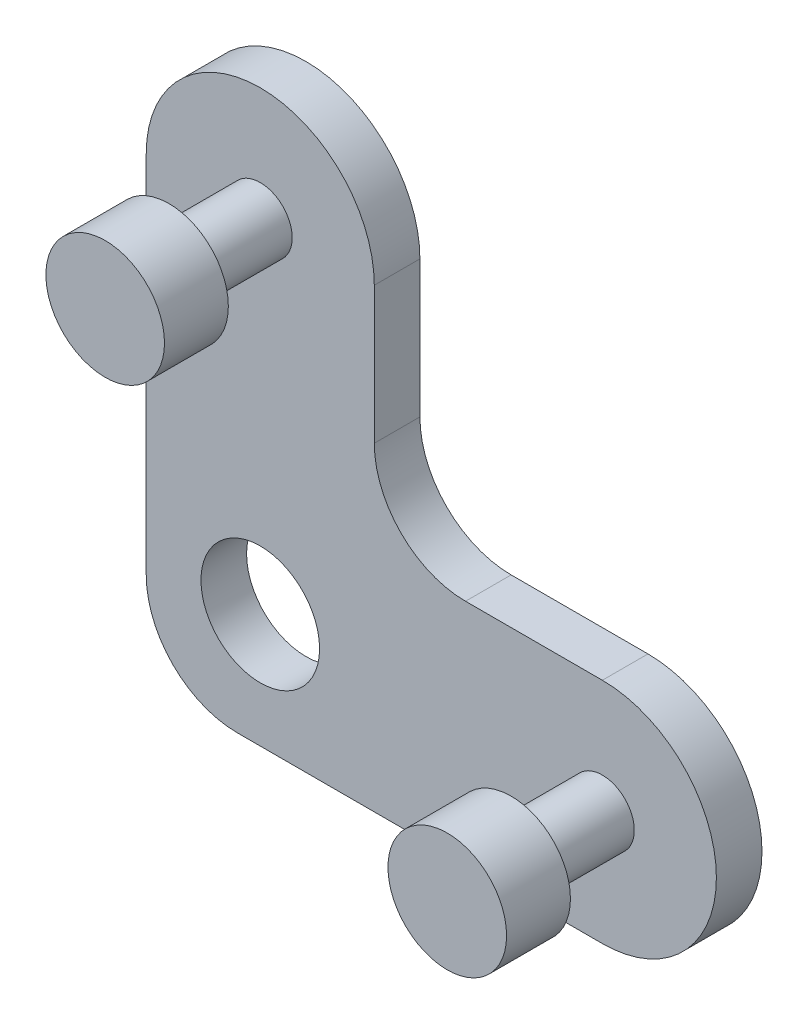
from build123d import *

# Parameters (mm, degrees)
BODY_DEPTH                  = 1.27
SKETCH2_R                   = 0.889
NUBS_DEPTH                  = 2.54
SKETCH3_R                   = 1.651
DON_T_LET_IT_FALL_OFF_DEPTH = 1.778
ATTACH_TO_SIDE_REACH        = 24.862
SKETCH5_R                   = 1.651


with BuildPart() as part:
    # Sketch1 → body (new body)
    with BuildSketch(Plane.XY):
        with BuildLine():
            Line((0, 12.7), (0, 2.54))
            ThreePointArc((0, 2.54), (0.743948776, 0.743948776), (2.54, 0))
            Line((2.54, 0), (12.7, 0))
            ThreePointArc((12.7, 0), (15.875, 3.175), (12.7, 6.35))
            Line((12.7, 6.35), (8.89, 6.35))
            ThreePointArc((8.89, 6.35), (7.093948776, 7.093948776), (6.35, 8.89))
            Line((6.35, 8.89), (6.35, 12.7))
            ThreePointArc((6.35, 12.7), (3.175, 15.875), (0, 12.7))
        make_face()
    extrude(amount=BODY_DEPTH)

    # Sketch2 → nubs (add)
    with BuildSketch(Plane.XY.offset(1.27)):
        with Locations((3.175, 12.7)):
            Circle(SKETCH2_R)
        with Locations((12.7, 3.175)):
            Circle(SKETCH2_R)
    extrude(amount=NUBS_DEPTH)

    # Sketch3 → don't let it fall off (add)
    with BuildSketch(Plane.XY.offset(3.81)):
        with Locations((12.7, 3.175)):
            Circle(SKETCH3_R)
        with Locations((3.175, 12.7)):
            Circle(SKETCH3_R)
    extrude(amount=DON_T_LET_IT_FALL_OFF_DEPTH)

    # Sketch5 → attach to side (cut, up to next)
    with BuildSketch(Plane.XY.offset(1.27), mode=Mode.PRIVATE) as attach_to_side_sk1:
        with Locations((3.175, 3.175)):
            Circle(SKETCH5_R)
    attach_to_side_tool1 = extrude(attach_to_side_sk1.sketch, amount=-ATTACH_TO_SIDE_REACH, mode=Mode.PRIVATE) & part.part
    add(attach_to_side_tool1.solids().sort_by_distance((3.175, 3.175, 1.27))[0], mode=Mode.SUBTRACT)


solid = part.part
